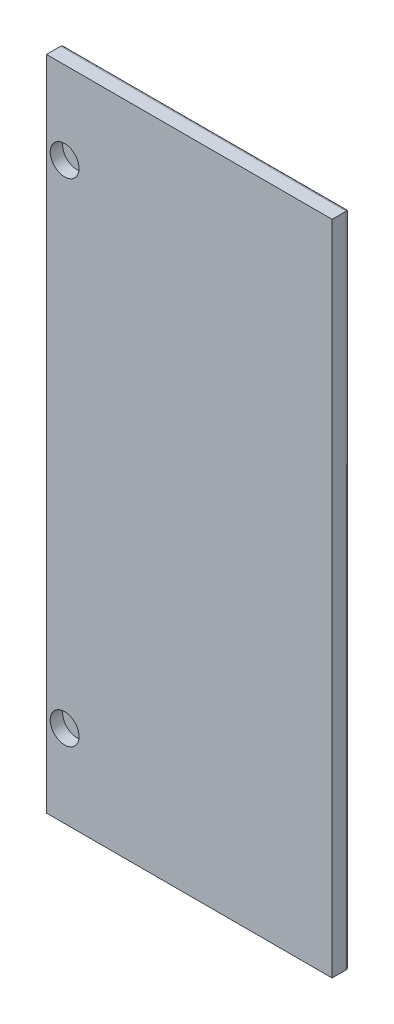
from build123d import *

# Parameters (mm, degrees)
SKETCH_1_W             = 346
SKETCH_1_H             = 796
EXTRUDE_1889_DEPTH     = 21
SKETCH_3_R             = 17.5
CUT_EXTRUDE_1_DEPTH    = 15
SKETCH_4_R             = 17.5
CUT_EXTRUDE_2_DEPTH    = 15
CUT_EXTRUDE_3637_DEPTH = 6
FILLET_1_R             = 4


with BuildPart() as part:
    # Эскиз1 → Extrude 1889 (new body)
    with BuildSketch(Plane.XY):
        with Locations((173, 398)):
            Rectangle(SKETCH_1_W, SKETCH_1_H)
    extrude(amount=EXTRUDE_1889_DEPTH)

    # Эскиз3 → Отверстие 1 (cut)
    with BuildSketch(Plane.XY.offset(21)):
        with Locations((22, 100)):
            Circle(SKETCH_3_R)
    extrude(amount=-CUT_EXTRUDE_1_DEPTH, mode=Mode.SUBTRACT)

    # Эскиз4 → Отверстие 2 (cut)
    with BuildSketch(Plane.XY.offset(21)):
        with Locations((22, 696)):
            Circle(SKETCH_4_R)
    extrude(amount=-CUT_EXTRUDE_2_DEPTH, mode=Mode.SUBTRACT)

    # Эскиз11 → Cut-Extrude 3637 (cut)
    # profile 1 of 2: a face of its own
    with BuildSketch(Plane(origin=(0, 0, 0), x_dir=(-1, 0, 0), z_dir=(0, 0, -1))):
        with BuildLine():
            Line((-309, 719.600882186), (-309, 76.399117814))
            ThreePointArc((-309, 76.399117814), (-275.192388155, 70.807611845), (-269.600882186, 37))
            Line((-269.600882186, 37), (-76.399117814, 37))
            ThreePointArc((-76.399117814, 37), (-70.807611845, 70.807611845), (-37, 76.399117814))
            Line((-37, 76.399117814), (-37, 719.600882186))
            ThreePointArc((-37, 719.600882186), (-70.807611845, 725.192388155), (-76.399117814, 759))
            Line((-76.399117814, 759), (-269.600882186, 759))
            ThreePointArc((-269.600882186, 759), (-275.192388155, 725.192388155), (-309, 719.600882186))
        make_face()
        with BuildLine():
            ThreePointArc((-306, 715.154062462), (-273.071067812, 723.071067812), (-265.154062462, 756))
            Line((-265.154062462, 756), (-80.845937538, 756))
            ThreePointArc((-80.845937538, 756), (-72.928932188, 723.071067812), (-40, 715.154062462))
            Line((-40, 715.154062462), (-40, 80.845937538))
            ThreePointArc((-40, 80.845937538), (-72.928932188, 72.928932188), (-80.845937538, 40))
            Line((-80.845937538, 40), (-265.154062462, 40))
            ThreePointArc((-265.154062462, 40), (-273.071067812, 72.928932188), (-306, 80.845937538))
            Line((-306, 80.845937538), (-306, 715.154062462))
        make_face(mode=Mode.SUBTRACT)
    # profile 2 of 2: a face of its own
    with BuildSketch(Plane(origin=(0, 0, 0), x_dir=(-1, 0, 0), z_dir=(0, 0, -1))):
        with BuildLine():
            ThreePointArc((-296, 92.426406871), (-266, 80), (-253.573593129, 50))
            Line((-253.573593129, 50), (-92.426406871, 50))
            ThreePointArc((-92.426406871, 50), (-80, 80), (-50, 92.426406871))
            Line((-50, 92.426406871), (-50, 703.573593129))
            ThreePointArc((-50, 703.573593129), (-80, 716), (-92.426406871, 746))
            Line((-92.426406871, 746), (-253.573593129, 746))
            ThreePointArc((-253.573593129, 746), (-266, 716), (-296, 703.573593129))
            Line((-296, 703.573593129), (-296, 92.426406871))
        make_face()
    extrude(amount=-CUT_EXTRUDE_3637_DEPTH, mode=Mode.SUBTRACT)

    # Скругление1
    fillet_1_edges = [part.edges().sort_by_distance(p)[0] for p in [
        (173, 0, 0),
        (346, 398, 0),
        (173, 796, 0),
        (0, 398, 0),
    ]]
    fillet(fillet_1_edges, radius=FILLET_1_R)


solid = part.part
